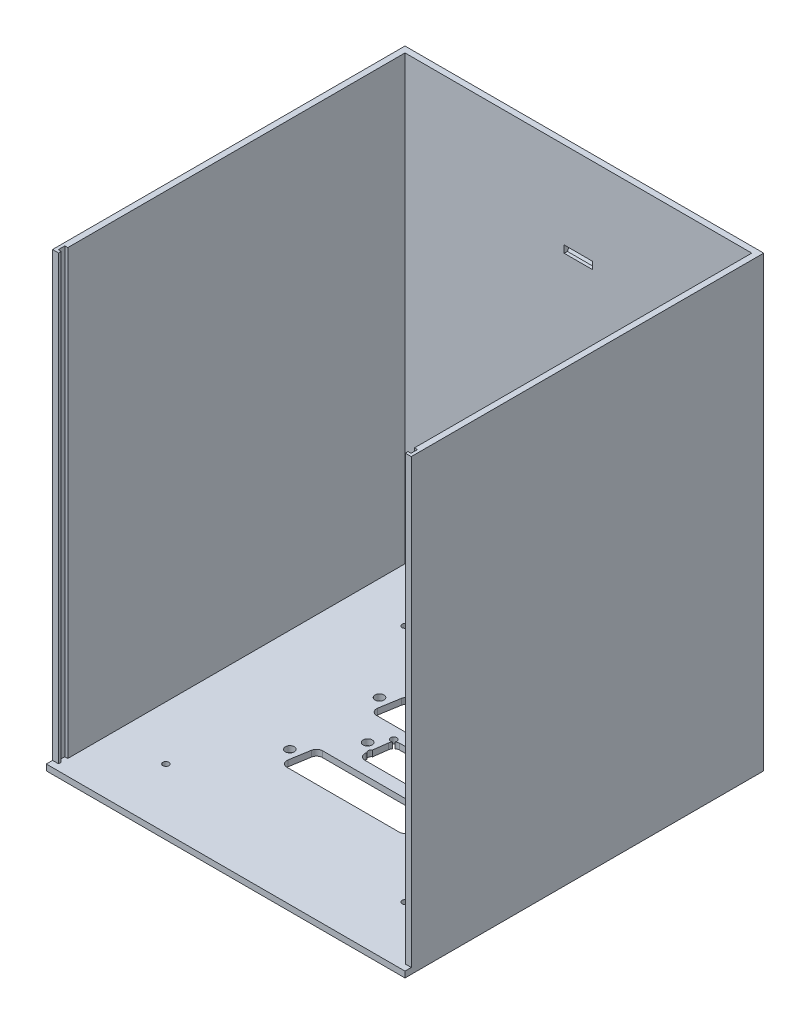
from build123d import *

# Parameters (mm, degrees)
SKETCH1_W             = 120
SKETCH1_H             = 120
MAIN_BODY_DEPTH       = 150
SKETCH11_W            = 116
SKETCH11_H            = 118
HOLLOW_DEPTH          = 148
SKETCH12_W            = 2
SKETCH12_H            = 2.1
LID_CUT_DEPTH         = 148
SKETCH13_W            = 1
SKETCH13_H            = 2.2
RAIL_CUT_DEPTH        = 148
MAIN_PCB_HOLES_REACH  = 174.337
SKETCH2_R             = 1
LED_PCB_HOLES_REACH   = 174.337
SKETCH3_R             = 1.05
CONNECTOR_SLOTS_REACH = 174.337
SKETCH4_R             = 1.5
CUT_EXTRUDE1_DEPTH    = 4.75


with BuildPart() as part:
    # Sketch1 → Main-Body (new body)
    with BuildSketch(Plane(origin=(0, 0, 0), x_dir=(1, 0, 0), z_dir=(0, 1, 0))):
        Rectangle(SKETCH1_W, SKETCH1_H)
    extrude(amount=MAIN_BODY_DEPTH)

    # Sketch11 → Hollow (cut)
    with BuildSketch(Plane(origin=(0, 150, 0), x_dir=(1, 0, 0), z_dir=(0, 1, 0))):
        with Locations((0, -1)):
            Rectangle(SKETCH11_W, SKETCH11_H)
    extrude(amount=-HOLLOW_DEPTH, mode=Mode.SUBTRACT)

    # Sketch12 → Lid-Cut (cut)
    with BuildSketch(Plane(origin=(0, 150, 0), x_dir=(1, 0, 0), z_dir=(0, 1, 0))):
        with Locations((-59, -58.95)):
            Rectangle(SKETCH12_W, SKETCH12_H)
    lid_cut = extrude(amount=-LID_CUT_DEPTH, mode=Mode.SUBTRACT)

    # Mirror-Lid-Cut: Lid-Cut across plane
    add(lid_cut.mirror(Plane(origin=(0, 0, 0), x_dir=(0, 0, 1), z_dir=(1, 0, 0))), mode=Mode.SUBTRACT)

    # Sketch13 → Rail-Cut (cut)
    with BuildSketch(Plane(origin=(0, 150, 0), x_dir=(1, 0, 0), z_dir=(0, 1, 0))):
        with Locations((-58.5, -55.9)):
            Rectangle(SKETCH13_W, SKETCH13_H)
    rail_cut = extrude(amount=-RAIL_CUT_DEPTH, mode=Mode.SUBTRACT)

    # Mirror-Rail-Cut: Rail-Cut across plane
    add(rail_cut.mirror(Plane(origin=(0, 0, 0), x_dir=(0, 0, 1), z_dir=(1, 0, 0))), mode=Mode.SUBTRACT)

    # Sketch2 → Main-PCB-Holes (cut, up to next)
    with BuildSketch(Plane.XZ, mode=Mode.PRIVATE) as main_pcb_holes_sk1:
        with Locations((-40, 40)):
            Circle(SKETCH2_R)
    main_pcb_holes_tool1 = extrude(main_pcb_holes_sk1.sketch, amount=-MAIN_PCB_HOLES_REACH, mode=Mode.PRIVATE) & part.part
    # Sketch2 → Main-PCB-Holes (cut, up to next)
    with BuildSketch(Plane.XZ, mode=Mode.PRIVATE) as main_pcb_holes_sk2:
        with Locations((40, 40)):
            Circle(SKETCH2_R)
    main_pcb_holes_tool2 = extrude(main_pcb_holes_sk2.sketch, amount=-MAIN_PCB_HOLES_REACH, mode=Mode.PRIVATE) & part.part
    # Sketch2 → Main-PCB-Holes (cut, up to next)
    with BuildSketch(Plane.XZ, mode=Mode.PRIVATE) as main_pcb_holes_sk3:
        with Locations((40, -40)):
            Circle(SKETCH2_R)
    main_pcb_holes_tool3 = extrude(main_pcb_holes_sk3.sketch, amount=-MAIN_PCB_HOLES_REACH, mode=Mode.PRIVATE) & part.part
    # Sketch2 → Main-PCB-Holes (cut, up to next)
    with BuildSketch(Plane.XZ, mode=Mode.PRIVATE) as main_pcb_holes_sk4:
        with Locations((-40, -40)):
            Circle(SKETCH2_R)
    main_pcb_holes_tool4 = extrude(main_pcb_holes_sk4.sketch, amount=-MAIN_PCB_HOLES_REACH, mode=Mode.PRIVATE) & part.part
    add(main_pcb_holes_tool1.solids().sort_by_distance((-40, 0, 40))[0], mode=Mode.SUBTRACT)
    add(main_pcb_holes_tool2.solids().sort_by_distance((40, 0, 40))[0], mode=Mode.SUBTRACT)
    add(main_pcb_holes_tool3.solids().sort_by_distance((40, 0, -40))[0], mode=Mode.SUBTRACT)
    add(main_pcb_holes_tool4.solids().sort_by_distance((-40, 0, -40))[0], mode=Mode.SUBTRACT)

    # Sketch3 → LED-PCB-Holes (cut, up to next)
    with BuildSketch(Plane(origin=(0, 150, 0), x_dir=(1, 0, 0), z_dir=(0, 1, 0)), mode=Mode.PRIVATE) as led_pcb_holes_sk1:
        with Locations((-9, 5.23)):
            Circle(SKETCH3_R)
    led_pcb_holes_tool1 = extrude(led_pcb_holes_sk1.sketch, amount=-LED_PCB_HOLES_REACH, mode=Mode.PRIVATE) & part.part
    # Sketch3 → LED-PCB-Holes (cut, up to next)
    with BuildSketch(Plane(origin=(0, 150, 0), x_dir=(1, 0, 0), z_dir=(0, 1, 0)), mode=Mode.PRIVATE) as led_pcb_holes_sk2:
        with Locations((9, 5.23)):
            Circle(SKETCH3_R)
    led_pcb_holes_tool2 = extrude(led_pcb_holes_sk2.sketch, amount=-LED_PCB_HOLES_REACH, mode=Mode.PRIVATE) & part.part
    # Sketch3 → LED-PCB-Holes (cut, up to next)
    with BuildSketch(Plane(origin=(0, 150, 0), x_dir=(1, 0, 0), z_dir=(0, 1, 0)), mode=Mode.PRIVATE) as led_pcb_holes_sk3:
        with Locations((9, -2.27)):
            Circle(SKETCH3_R)
    led_pcb_holes_tool3 = extrude(led_pcb_holes_sk3.sketch, amount=-LED_PCB_HOLES_REACH, mode=Mode.PRIVATE) & part.part
    # Sketch3 → LED-PCB-Holes (cut, up to next)
    with BuildSketch(Plane(origin=(0, 150, 0), x_dir=(1, 0, 0), z_dir=(0, 1, 0)), mode=Mode.PRIVATE) as led_pcb_holes_sk4:
        with Locations((-9, -2.27)):
            Circle(SKETCH3_R)
    led_pcb_holes_tool4 = extrude(led_pcb_holes_sk4.sketch, amount=-LED_PCB_HOLES_REACH, mode=Mode.PRIVATE) & part.part
    add(led_pcb_holes_tool1.solids().sort_by_distance((-9, 150, -5.23))[0], mode=Mode.SUBTRACT)
    add(led_pcb_holes_tool2.solids().sort_by_distance((9, 150, -5.23))[0], mode=Mode.SUBTRACT)
    add(led_pcb_holes_tool3.solids().sort_by_distance((9, 150, 2.27))[0], mode=Mode.SUBTRACT)
    add(led_pcb_holes_tool4.solids().sort_by_distance((-9, 150, 2.27))[0], mode=Mode.SUBTRACT)

    # Sketch4 → Connector-Slots (cut, up to next)
    with BuildSketch(Plane.XZ, mode=Mode.PRIVATE) as connector_slots_sk1:
        with Locations((-12.5, 0)):
            Circle(SKETCH4_R)
    connector_slots_tool1 = extrude(connector_slots_sk1.sketch, amount=-CONNECTOR_SLOTS_REACH, mode=Mode.PRIVATE) & part.part
    # Sketch4 → Connector-Slots (cut, up to next)
    with BuildSketch(Plane.XZ, mode=Mode.PRIVATE) as connector_slots_sk2:
        with Locations((12.5, 0)):
            Circle(SKETCH4_R)
    connector_slots_tool2 = extrude(connector_slots_sk2.sketch, amount=-CONNECTOR_SLOTS_REACH, mode=Mode.PRIVATE) & part.part
    # Sketch4 → Connector-Slots (cut, up to next)
    with BuildSketch(Plane.XZ, mode=Mode.PRIVATE) as connector_slots_sk3:
        with Locations((-23.52, -15)):
            Circle(SKETCH4_R)
    connector_slots_tool3 = extrude(connector_slots_sk3.sketch, amount=-CONNECTOR_SLOTS_REACH, mode=Mode.PRIVATE) & part.part
    # Sketch4 → Connector-Slots (cut, up to next)
    with BuildSketch(Plane.XZ, mode=Mode.PRIVATE) as connector_slots_sk4:
        with Locations((23.52, -15)):
            Circle(SKETCH4_R)
    connector_slots_tool4 = extrude(connector_slots_sk4.sketch, amount=-CONNECTOR_SLOTS_REACH, mode=Mode.PRIVATE) & part.part
    # Sketch4 → Connector-Slots (cut, up to next)
    with BuildSketch(Plane.XZ, mode=Mode.PRIVATE) as connector_slots_sk5:
        with Locations((-23.52, 15)):
            Circle(SKETCH4_R)
    connector_slots_tool5 = extrude(connector_slots_sk5.sketch, amount=-CONNECTOR_SLOTS_REACH, mode=Mode.PRIVATE) & part.part
    # Sketch4 → Connector-Slots (cut, up to next)
    with BuildSketch(Plane.XZ, mode=Mode.PRIVATE) as connector_slots_sk6:
        with Locations((23.52, 15)):
            Circle(SKETCH4_R)
    connector_slots_tool6 = extrude(connector_slots_sk6.sketch, amount=-CONNECTOR_SLOTS_REACH, mode=Mode.PRIVATE) & part.part
    # Sketch4 → Connector-Slots (cut, up to next)
    with BuildSketch(Plane.XZ, mode=Mode.PRIVATE) as connector_slots_sk7:
        with BuildLine():
            Line((-6.891594987, -5.117891943), (6.891594987, -5.117891943))
            ThreePointArc((6.891594987, -5.117891943), (8.211781315, -4.620259427), (8.875, -3.375))
            Line((8.875, -3.375), (9.75, 3.375))
            ThreePointArc((9.75, 3.375), (9.268962471, 4.952294386), (7.766594987, 5.632108057))
            Line((7.766594987, 5.632108057), (-7.766594987, 5.632108057))
            ThreePointArc((-7.766594987, 5.632108057), (-9.268962471, 4.952294386), (-9.75, 3.375))
            Line((-9.75, 3.375), (-8.875, -3.375))
            ThreePointArc((-8.875, -3.375), (-8.211781315, -4.620259427), (-6.891594987, -5.117891943))
        make_face()
    connector_slots_tool7 = extrude(connector_slots_sk7.sketch, amount=-CONNECTOR_SLOTS_REACH, mode=Mode.PRIVATE) & part.part
    # Sketch4 → Connector-Slots (cut, up to next)
    with BuildSketch(Plane.XZ, mode=Mode.PRIVATE) as connector_slots_sk8:
        with BuildLine():
            Line((-17.652212152, -20.046202025), (17.652212152, -20.046202025))
            ThreePointArc((17.652212152, -20.046202025), (18.944961945, -19.57224199), (19.625, -18.375))
            Line((19.625, -18.375), (20.75, -11.625))
            ThreePointArc((20.75, -11.625), (20.303252117, -10.003452233), (18.777212152, -9.296202025))
            Line((18.777212152, -9.296202025), (-18.777212152, -9.296202025))
            ThreePointArc((-18.777212152, -9.296202025), (-20.303252117, -10.003452233), (-20.75, -11.625))
            Line((-20.75, -11.625), (-19.625, -18.375))
            ThreePointArc((-19.625, -18.375), (-18.944961945, -19.57224199), (-17.652212152, -20.046202025))
        make_face()
    connector_slots_tool8 = extrude(connector_slots_sk8.sketch, amount=-CONNECTOR_SLOTS_REACH, mode=Mode.PRIVATE) & part.part
    # Sketch4 → Connector-Slots (cut, up to next)
    with BuildSketch(Plane.XZ, mode=Mode.PRIVATE) as connector_slots_sk9:
        with BuildLine():
            Line((-17.652212152, 9.953797975), (17.652212152, 9.953797975))
            ThreePointArc((17.652212152, 9.953797975), (18.944961945, 10.42775801), (19.625, 11.625))
            Line((19.625, 11.625), (20.75, 18.375))
            ThreePointArc((20.75, 18.375), (20.303252117, 19.996547767), (18.777212152, 20.703797975))
            Line((18.777212152, 20.703797975), (-18.777212152, 20.703797975))
            ThreePointArc((-18.777212152, 20.703797975), (-20.303252117, 19.996547767), (-20.75, 18.375))
            Line((-20.75, 18.375), (-19.625, 11.625))
            ThreePointArc((-19.625, 11.625), (-18.944961945, 10.42775801), (-17.652212152, 9.953797975))
        make_face()
    connector_slots_tool9 = extrude(connector_slots_sk9.sketch, amount=-CONNECTOR_SLOTS_REACH, mode=Mode.PRIVATE) & part.part
    add(connector_slots_tool1.solids().sort_by_distance((-12.5, 0, 0))[0], mode=Mode.SUBTRACT)
    add(connector_slots_tool2.solids().sort_by_distance((12.5, 0, 0))[0], mode=Mode.SUBTRACT)
    add(connector_slots_tool3.solids().sort_by_distance((-23.52, 0, -15))[0], mode=Mode.SUBTRACT)
    add(connector_slots_tool4.solids().sort_by_distance((23.52, 0, -15))[0], mode=Mode.SUBTRACT)
    add(connector_slots_tool5.solids().sort_by_distance((-23.52, 0, 15))[0], mode=Mode.SUBTRACT)
    add(connector_slots_tool6.solids().sort_by_distance((23.52, 0, 15))[0], mode=Mode.SUBTRACT)
    add(connector_slots_tool7.solids().sort_by_distance((0, 0, 0.368259))[0], mode=Mode.SUBTRACT)
    add(connector_slots_tool8.solids().sort_by_distance((0, 0, -14.605881))[0], mode=Mode.SUBTRACT)
    add(connector_slots_tool9.solids().sort_by_distance((0, 0, 15.394119))[0], mode=Mode.SUBTRACT)

    # Sketch14 → Cut-Extrude1 (cut, symmetric)
    with BuildSketch(Plane(origin=(0, 0, 0), x_dir=(0, 0, -1), z_dir=(1, 0, 0))):
        Polygon((58, 121), (60, 121), (60, 120.88), (60, 119.88), (59.82055535, 119.88), (59.07, 118.58), (58, 118.58), align=None)
    extrude(amount=CUT_EXTRUDE1_DEPTH, both=True, mode=Mode.SUBTRACT)


solid = part.part
